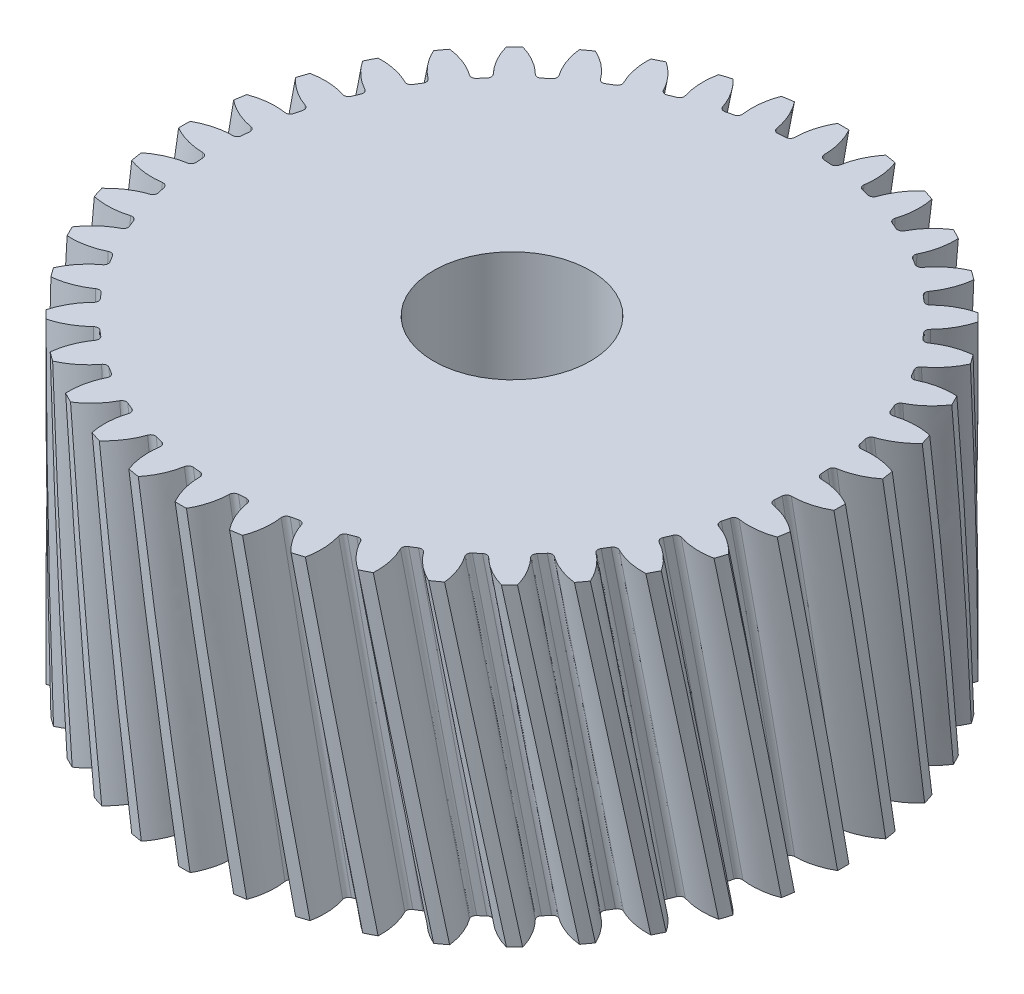
from build123d import *

# Parameters (mm, degrees)
SKETCH1_R                = 21
BOSS_EXTRUDE1_DEPTH      = 10
FILLET2_R                = 0.3
CIRPATTERN3_COUNT        = 40
FILLET2_OF_CIRPATTERN3_R = 0.3
SKETCH8_R                = 5
CUT_EXTRUDE1_DEPTH       = 36.805027766


with BuildPart() as part:
    # Sketch1 → Boss-Extrude1 (new, symmetric)
    with BuildSketch(Plane(origin=(0, 0, 0), x_dir=(1, 0, 0), z_dir=(0, 1, 0))):
        with Locations(Location((0, 0, 0), (0, 0, 270))):
            Circle(SKETCH1_R)
    extrude(amount=BOSS_EXTRUDE1_DEPTH, both=True)

    # Sketch6 for Cut-Loft1 → Cut-Loft1 section 0
    with BuildSketch(Plane(origin=(0, 10, 0), x_dir=(0.996468685074596, 0, 0.08396522890879286), z_dir=(0, 1, 0))):
        with BuildLine():
            # circular arc as an exact rational Bezier (weights 1, cos(half-angle), 1)
            Bezier((-2.139593078, 21.895710572), (-0.576163769, 20.613758637), (-0.519675362, 18.592738839), weights=[1, 0.909785534, 1])
            Bezier((-0.519675362, 18.592738839), (0, 18.607263997), (0.519675362, 18.592738839), weights=[1, 0.999609615, 1])
            Bezier((0.519675362, 18.592738839), (0.576163769, 20.613758637), (2.139593078, 21.895710572), weights=[1, 0.909785534, 1])
            Bezier((2.139593078, 21.895710572), (0, 22.104786159), (-2.139593078, 21.895710572), weights=[1, 0.995259571, 1])
        make_face()
    # Sketch2 for Cut-Loft1 → Cut-Loft1 section 1
    with BuildSketch(Plane(origin=(0, 0, 0), x_dir=(1, 0, 0), z_dir=(0, 1, 0))):
        with BuildLine():
            Bezier((-2.139593078, 21.895710572), (-0.576163769, 20.613758637), (-0.519675362, 18.592738839), weights=[1, 0.909785534, 1])
            Bezier((-0.519675362, 18.592738839), (0, 18.607263997), (0.519675362, 18.592738839), weights=[1, 0.999609615, 1])
            Bezier((0.519675362, 18.592738839), (0.576163769, 20.613758637), (2.139593078, 21.895710572), weights=[1, 0.909785534, 1])
            Bezier((2.139593078, 21.895710572), (0, 22.104786159), (-2.139593078, 21.895710572), weights=[1, 0.995259571, 1])
        make_face()
    # Sketch7 for Cut-Loft1 → Cut-Loft1 section 2
    with BuildSketch(Plane(origin=(0, -10, 0), x_dir=(0.9964686850745959, 0, -0.08396522890879275), z_dir=(0, 1, 0))):
        with BuildLine():
            Bezier((-2.139593078, 21.895710572), (-0.576163769, 20.613758637), (-0.519675362, 18.592738839), weights=[1, 0.909785534, 1])
            Bezier((-0.519675362, 18.592738839), (0, 18.607263997), (0.519675362, 18.592738839), weights=[1, 0.999609615, 1])
            Bezier((0.519675362, 18.592738839), (0.576163769, 20.613758637), (2.139593078, 21.895710572), weights=[1, 0.909785534, 1])
            Bezier((2.139593078, 21.895710572), (0, 22.104786159), (-2.139593078, 21.895710572), weights=[1, 0.995259571, 1])
        make_face()
    cut_loft1 = loft(mode=Mode.SUBTRACT)

    # Fillet2
    fillet2_edges = [part.edges().sort_by_distance(p)[0] for p in [
        (0.519675362, 0, -18.592738839),
        (-0.519675362, 0, -18.592738839),
    ]]
    fillet(fillet2_edges, radius=FILLET2_R)

    # CirPattern3: Cut-Loft1 ×40 about axis
    cirpattern3_axis = Axis((0, 10, 0), (0, -1, 0))
    for i in range(1, CIRPATTERN3_COUNT):
        add(cut_loft1.rotate(cirpattern3_axis, i * 360 / CIRPATTERN3_COUNT), mode=Mode.SUBTRACT)

    # Fillet2 of CirPattern3
    fillet2_of_cirpattern3_edges = [part.edges().sort_by_distance(p)[0] for p in [
        (3.42182245, 0, -18.282536233),
        (2.395267858, 0, -18.445126508),
        (6.239712913, 0, -17.52215691),
        (5.251231633, 0, -17.843333947),
        (8.903960935, 0, -16.33032393),
        (7.977892658, 0, -16.802179285),
        (11.348963889, 0, -14.736384178),
        (10.508111489, 0, -15.347299206),
        (13.514517686, 0, -12.779585741),
        (12.779585741, 0, -13.514517686),
        (15.347299206, 0, -10.508111489),
        (14.736384178, 0, -11.348963889),
        (16.802179285, 0, -7.977892658),
        (16.33032393, 0, -8.903960935),
        (17.843333947, 0, -5.251231633),
        (17.52215691, 0, -6.239712913),
        (18.445126508, 0, -2.395267858),
        (18.282536233, 0, -3.42182245),
        (18.592738839, 0, 0.519675362),
        (18.592738839, 0, -0.519675362),
        (18.282536233, 0, 3.42182245),
        (18.445126508, 0, 2.395267858),
        (17.52215691, 0, 6.239712913),
        (17.843333947, 0, 5.251231633),
        (16.33032393, 0, 8.903960935),
        (16.802179285, 0, 7.977892658),
        (14.736384178, 0, 11.348963889),
        (15.347299206, 0, 10.508111489),
        (12.779585741, 0, 13.514517686),
        (13.514517686, 0, 12.779585741),
        (10.508111489, 0, 15.347299206),
        (11.348963889, 0, 14.736384178),
        (7.977892658, 0, 16.802179285),
        (8.903960935, 0, 16.33032393),
        (5.251231633, 0, 17.843333947),
        (6.239712913, 0, 17.52215691),
        (2.395267858, 0, 18.445126508),
        (3.42182245, 0, 18.282536233),
        (-0.519675362, 0, 18.592738839),
        (0.519675362, 0, 18.592738839),
        (-3.42182245, 0, 18.282536233),
        (-2.395267858, 0, 18.445126508),
        (-6.239712913, 0, 17.52215691),
        (-5.251231633, 0, 17.843333947),
        (-8.903960935, 0, 16.33032393),
        (-7.977892658, 0, 16.802179285),
        (-11.348963889, 0, 14.736384178),
        (-10.508111489, 0, 15.347299206),
        (-13.514517686, 0, 12.779585741),
        (-12.779585741, 0, 13.514517686),
        (-15.347299206, 0, 10.508111489),
        (-14.736384178, 0, 11.348963889),
        (-16.802179285, 0, 7.977892658),
        (-16.33032393, 0, 8.903960935),
        (-17.843333947, 0, 5.251231633),
        (-17.52215691, 0, 6.239712913),
        (-18.445126508, 0, 2.395267858),
        (-18.282536233, 0, 3.42182245),
        (-18.592738839, 0, -0.519675362),
        (-18.592738839, 0, 0.519675362),
        (-18.282536233, 0, -3.42182245),
        (-18.445126508, 0, -2.395267858),
        (-17.52215691, 0, -6.239712913),
        (-17.843333947, 0, -5.251231633),
        (-16.33032393, 0, -8.903960935),
        (-16.802179285, 0, -7.977892658),
        (-14.736384178, 0, -11.348963889),
        (-15.347299206, 0, -10.508111489),
        (-12.779585741, 0, -13.514517686),
        (-13.514517686, 0, -12.779585741),
        (-10.508111489, 0, -15.347299206),
        (-11.348963889, 0, -14.736384178),
        (-7.977892658, 0, -16.802179285),
        (-8.903960935, 0, -16.33032393),
        (-5.251231633, 0, -17.843333947),
        (-6.239712913, 0, -17.52215691),
        (-2.395267858, 0, -18.445126508),
        (-3.42182245, 0, -18.282536233),
    ]]
    fillet(fillet2_of_cirpattern3_edges, radius=FILLET2_OF_CIRPATTERN3_R)

    # Sketch8 → Cut-Extrude1 (cut, through all)
    with BuildSketch(Plane(origin=(0, 10, 0), x_dir=(1, 0, 0), z_dir=(0, 1, 0))):
        with Locations(Location((0, 0, 0), (0, 0, 270))):
            Circle(SKETCH8_R)
    extrude(amount=-CUT_EXTRUDE1_DEPTH, mode=Mode.SUBTRACT)


solid = part.part
